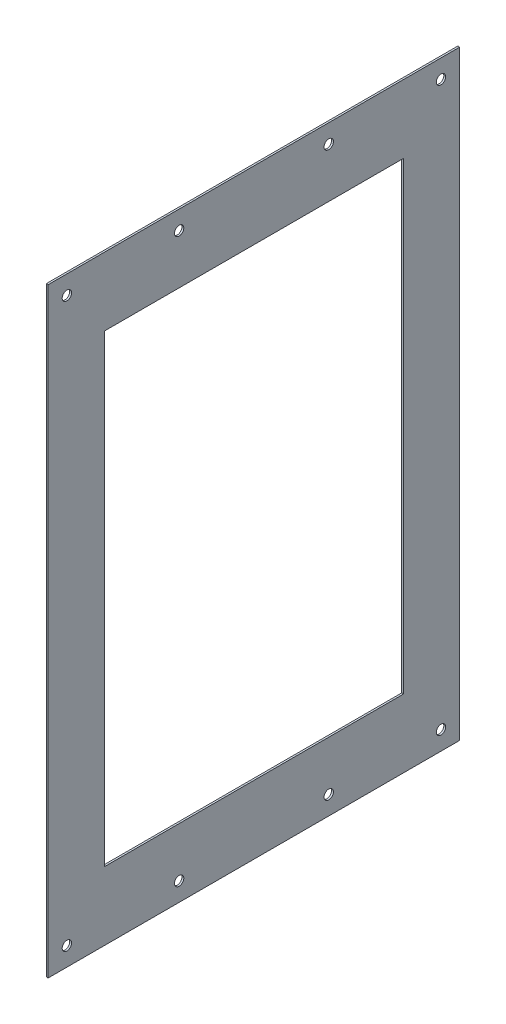
from build123d import *

# Parameters (mm, degrees)
SKETCH1_W           = 321
SKETCH1_H           = 220
BOSS_EXTRUDE1_DEPTH = 1
SKETCH2_R           = 2.5
CUT_EXTRUDE1_DEPTH  = 195.579675198
SKETCH3_W           = 248
SKETCH3_H           = 160
CUT_EXTRUDE2_DEPTH  = 195.579675198
SKETCH4_R           = 2.5
CUT_EXTRUDE3_DEPTH  = 195.579675198


with BuildPart() as part:
    # Sketch1 → Boss-Extrude1 (new body)
    with BuildSketch(Plane.YZ):
        Rectangle(SKETCH1_W, SKETCH1_H)
    extrude(amount=BOSS_EXTRUDE1_DEPTH)

    # Sketch2 → Cut-Extrude1 (cut, through all)
    with BuildSketch(Plane.YZ.offset(1)):
        with Locations((-150.5, 100)):
            Circle(SKETCH2_R)
        with Locations((150.5, 100)):
            Circle(SKETCH2_R)
        with Locations((-150.5, -100)):
            Circle(SKETCH2_R)
        with Locations((150.5, -100)):
            Circle(SKETCH2_R)
    extrude(amount=-CUT_EXTRUDE1_DEPTH, mode=Mode.SUBTRACT)

    # Sketch3 → Cut-Extrude2 (cut, through all)
    with BuildSketch(Plane.YZ.offset(1)):
        Rectangle(SKETCH3_W, SKETCH3_H)
    extrude(amount=-CUT_EXTRUDE2_DEPTH, mode=Mode.SUBTRACT)

    # Sketch4 → Cut-Extrude3 (cut, through all)
    with BuildSketch(Plane.YZ.offset(1)):
        with Locations((-150.5, 40)):
            Circle(SKETCH4_R)
        with Locations((150.5, 40)):
            Circle(SKETCH4_R)
        with Locations((-150.5, -40)):
            Circle(SKETCH4_R)
        with Locations((150.5, -40)):
            Circle(SKETCH4_R)
    extrude(amount=-CUT_EXTRUDE3_DEPTH, mode=Mode.SUBTRACT)


solid = part.part
